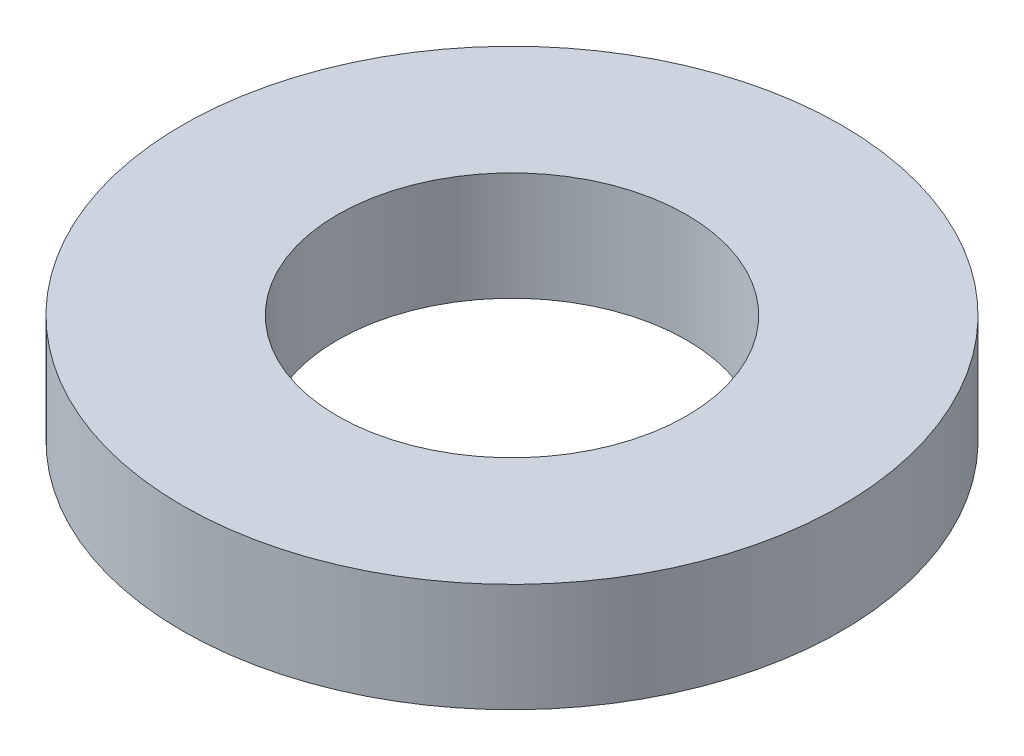
from build123d import *

# Parameters (mm, degrees)
SKETCH1_R           = 85
BOSS_EXTRUDE1_DEPTH = 28
SKETCH2_R           = 45
CUT_EXTRUDE1_DEPTH  = 124.426091245


with BuildPart() as part:
    # Sketch1 → Boss-Extrude1 (new body)
    with BuildSketch(Plane(origin=(0, 0, 0), x_dir=(1, 0, 0), z_dir=(0, 1, 0))):
        Circle(SKETCH1_R)
    extrude(amount=BOSS_EXTRUDE1_DEPTH)

    # Sketch2 → Cut-Extrude1 (cut, through all)
    with BuildSketch(Plane(origin=(0, 0, 0), x_dir=(1, 0, 0), z_dir=(0, 1, 0))):
        Circle(SKETCH2_R)
    extrude(amount=CUT_EXTRUDE1_DEPTH, mode=Mode.SUBTRACT)


solid = part.part
